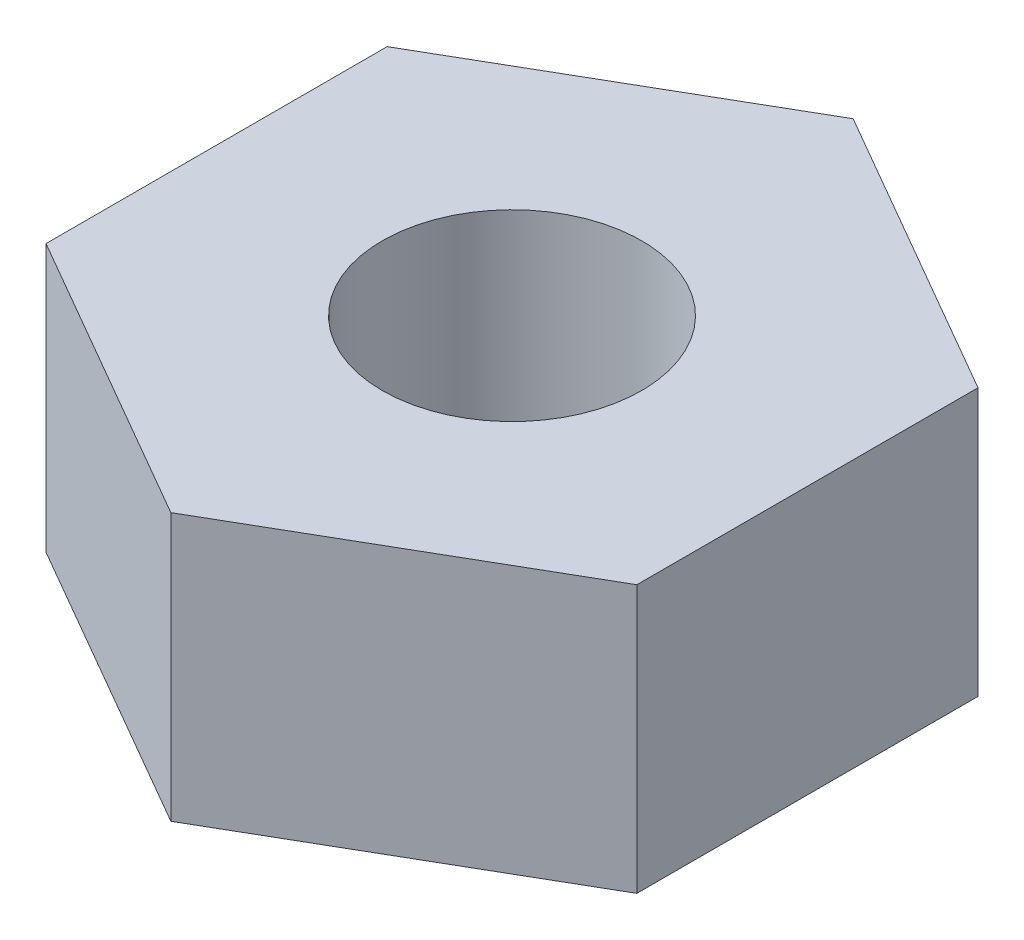
from build123d import *

# Parameters (mm, degrees)
SKETCH1_R           = 1.5
BOSS_EXTRUDE1_DEPTH = 3.09


with BuildPart() as part:
    # Sketch1 → Boss-Extrude1 (new body)
    with BuildSketch(Plane(origin=(0, 0, 0), x_dir=(1, 0, 0), z_dir=(0, 1, 0))):
        Polygon((0, -3.943302339), (3.415, -1.971651169), (3.415, 1.971651169), (0, 3.943302339), (-3.415, 1.971651169), (-3.415, -1.971651169), align=None)
        Circle(SKETCH1_R, mode=Mode.SUBTRACT)
    extrude(amount=BOSS_EXTRUDE1_DEPTH)


solid = part.part
